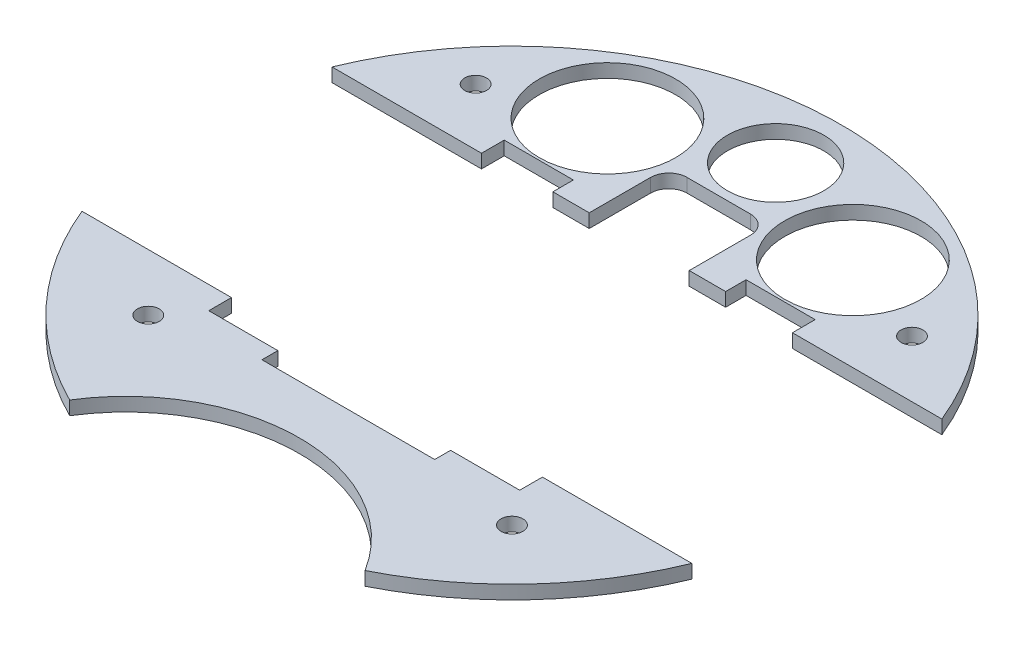
from build123d import *

# Parameters (mm, degrees)
BOSS_EXTRUDE1_DEPTH  = 3
SOLENOID_PLACEMENT_W = 38
SOLENOID_PLACEMENT_H = 64
CUT_EXTRUDE1_DEPTH   = 103.574363269
SKETCH3_R            = 12
CUT_EXTRUDE3_DEPTH   = 103.574363269
SKETCH4_R            = 2.4
CUT_EXTRUDE4_DEPTH   = 103.574363269
CUT_EXTRUDE2_DEPTH   = 103.574363269
CUT_EXTRUDE5_DEPTH   = 99.819279495
SKETCH6_R            = 15
CUT_EXTRUDE10_DEPTH  = 99.819279495
SKETCH7_R            = 10.605
CUT_EXTRUDE11_DEPTH  = 99.819279495


with BuildPart() as part:
    # Sketch1 → Boss-Extrude1 (new body)
    with BuildSketch(Plane(origin=(0, 0, 0), x_dir=(1, 0, 0), z_dir=(0, 1, 0))):
        with BuildLine():
            ThreePointArc((32.48910875, -64.812867647), (0, 72.5), (-32.48910875, -64.812867647))
            ThreePointArc((-32.48910875, -64.812867647), (0, -46.75), (32.48910875, -64.812867647))
        make_face()
    extrude(amount=BOSS_EXTRUDE1_DEPTH)

    # solenoid placement → Cut-Extrude1 (cut, through all)
    with BuildSketch(Plane(origin=(0, 3, 0), x_dir=(1, 0, 0), z_dir=(0, 1, 0))):
        with Locations((0, -4)):
            Rectangle(SOLENOID_PLACEMENT_W, SOLENOID_PLACEMENT_H)
    extrude(amount=-CUT_EXTRUDE1_DEPTH, mode=Mode.SUBTRACT)

    # Sketch3 → Cut-Extrude3 (cut, through all)
    with BuildSketch(Plane(origin=(0, 3, 0), x_dir=(1, 0, 0), z_dir=(0, 1, 0))):
        with Locations((27, 48)):
            Circle(SKETCH3_R)
        with Locations((-27, 48)):
            Circle(SKETCH3_R)
    extrude(amount=-CUT_EXTRUDE3_DEPTH, mode=Mode.SUBTRACT)

    # Sketch4 → Cut-Extrude4 (cut, through all)
    with BuildSketch(Plane(origin=(0, 3, 0), x_dir=(1, 0, 0), z_dir=(0, 1, 0))):
        with Locations((40, -40)):
            Circle(SKETCH4_R)
        with Locations((-40, -40)):
            Circle(SKETCH4_R)
        with Locations((48, 40)):
            Circle(SKETCH4_R)
        with Locations((-48, 40)):
            Circle(SKETCH4_R)
    extrude(amount=-CUT_EXTRUDE4_DEPTH, mode=Mode.SUBTRACT)

    # Sketch2 → Cut-Extrude2 (cut, through all)
    with BuildSketch(Plane(origin=(0, 3, 0), x_dir=(1, 0, 0), z_dir=(0, 1, 0))):
        with BuildLine():
            Line((34.2, -27.5), (34.2, -32.5))
            Line((34.2, -32.5), (22.2, -32.5))
            Line((22.2, -32.5), (19, -32.5))
            Line((19, -32.5), (19, 32.5))
            Line((19, 32.5), (22.2, 32.5))
            Line((22.2, 32.5), (34.2, 32.5))
            Line((34.2, 32.5), (34.2, 27.5))
            Line((34.2, 27.5), (67.082039325, 27.5))
            ThreePointArc((67.082039325, 27.5), (72.5, 0), (67.082039325, -27.5))
            Line((67.082039325, -27.5), (34.2, -27.5))
        make_face()
        with BuildLine():
            Line((-34.2, -32.5), (-22.2, -32.5))
            Line((-22.2, -32.5), (-19, -32.5))
            Line((-19, -32.5), (-19, 32.5))
            Line((-19, 32.5), (-22.2, 32.5))
            Line((-22.2, 32.5), (-34.2, 32.5))
            Line((-34.2, 32.5), (-34.2, 27.5))
            Line((-34.2, 27.5), (-67.082039325, 27.5))
            ThreePointArc((-67.082039325, 27.5), (-72.5, 0), (-67.082039325, -27.5))
            Line((-67.082039325, -27.5), (-34.2, -27.5))
            Line((-34.2, -27.5), (-34.2, -32.5))
        make_face()
    extrude(amount=-CUT_EXTRUDE2_DEPTH, mode=Mode.SUBTRACT)


with BuildPart() as cut_extrude2_piece_1:
    # of the separate pieces the step leaves, piece 1, a body of its own (cut_extrude2_pieces)
    add(part.part.solids().sort_by_distance((67.082039325, 0, -27.5))[0])

    # Sketch5 → Cut-Extrude5 (cut, through all)
    with BuildSketch(Plane(origin=(0, 3, 0), x_dir=(1, 0, 0), z_dir=(0, 1, 0))):
        with BuildLine():
            Line((-11, 41.5), (-11, 28))
            Line((-11, 28), (11, 28))
            Line((11, 28), (11, 41.5))
            ThreePointArc((11, 41.5), (9.828427125, 44.328427125), (7, 45.5))
            Line((7, 45.5), (-7, 45.5))
            ThreePointArc((-7, 45.5), (-9.828427125, 44.328427125), (-11, 41.5))
        make_face()
    extrude(amount=-CUT_EXTRUDE5_DEPTH, mode=Mode.SUBTRACT)

    # Sketch6 → Cut-Extrude10 (cut, through all)
    with BuildSketch(Plane(origin=(0, 3, 0), x_dir=(-1, 0, 0), z_dir=(0, 1, 0))):
        with Locations((-27, -48)):
            Circle(SKETCH6_R)
        with Locations((27, -48)):
            Circle(SKETCH6_R)
    extrude(amount=-CUT_EXTRUDE10_DEPTH, mode=Mode.SUBTRACT)

    # Sketch7 → Cut-Extrude11 (cut, through all)
    with BuildSketch(Plane(origin=(0, 3, 0), x_dir=(1, 0, 0), z_dir=(0, 1, 0))):
        with Locations((0, 58)):
            Circle(SKETCH7_R)
    extrude(amount=-CUT_EXTRUDE11_DEPTH, mode=Mode.SUBTRACT)


with BuildPart() as cut_extrude2_piece_2:
    # of the separate pieces the step leaves, piece 2, a body of its own (cut_extrude2_pieces)
    add(part.part.solids().sort_by_distance((32.48910875, 0, 64.812867647))[0])


solid = Compound([cut_extrude2_piece_1.part, cut_extrude2_piece_2.part])
